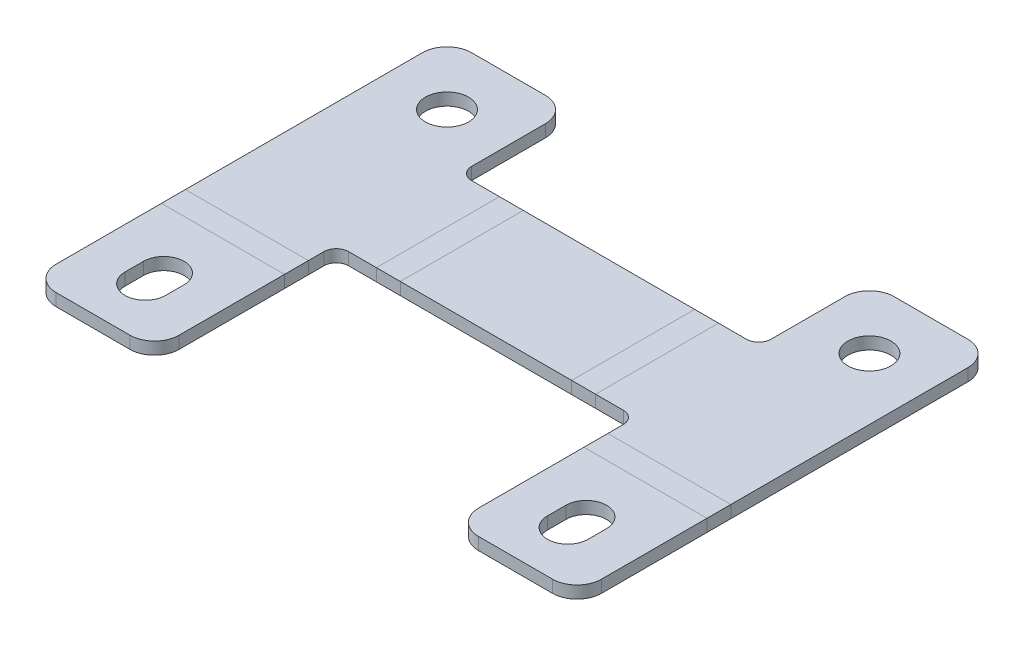
from build123d import *

# Parameters (mm, degrees)
SKETCH1_W                    = 7.7
SKETCH1_H                    = 10
BASE_FLANGE1_DEPTH           = 1
EDGE_FLANGE1_STRIP_W         = 5.4732
EDGE_FLANGE1_STRIP_H         = 1
EDGE_FLANGE1_STRIP_CUT_DEPTH = 10
EDGE_FLANGE1_DEPTH           = 10
SKETCH11_W                   = 23
SKETCH11_H                   = 10
TAB1_DEPTH                   = 1
FILLET1_R                    = 1
FILLET2_R                    = 2
SKETCH15_R                   = 1.75
CUT_EXTRUDE1_DEPTH           = 22.626141588
EDGE_FLANGE2_STRIP_W         = 5.4732
EDGE_FLANGE2_STRIP_H         = 1
EDGE_FLANGE2_STRIP_CUT_DEPTH = 10
EDGE_FLANGE2_DEPTH           = 10
CUT_EXTRUDE2_DEPTH           = 33.86335345
FILLET3_R                    = 2
UNFOLD1_DEPTH                = 14
UNFOLD1_START                = -1
UNFOLD1_2_OUTLINE_R          = 1.75
UNFOLD1_2_DEPTH              = 1


# Read off the part's stored shape, not the designer's step: Unfold1
# Sheet-metal steps are written as plain solids
with BuildPart() as part:
    # Sketch1 → Base-Flange1 (new body)
    with BuildSketch(Plane(origin=(0, 0, 0), x_dir=(1, 0, 0), z_dir=(0, 1, 0))):
        with Locations((3.85, 0)):
            Rectangle(SKETCH1_W, SKETCH1_H)
    extrude(amount=-BASE_FLANGE1_DEPTH)

    # Edge-Flange1 strip (across the edge) → Edge-Flange1 strip cut (cut)
    with BuildSketch(Plane(origin=(7.7, 0, 5), x_dir=(-1, 0, 0), z_dir=(0, 0, -1))):
        with Locations((-2, -0.5)):
            Rectangle(EDGE_FLANGE1_STRIP_W, EDGE_FLANGE1_STRIP_H)
    extrude(amount=EDGE_FLANGE1_STRIP_CUT_DEPTH, mode=Mode.SUBTRACT)

    # Edge-Flange1 section (across the edge) → Edge-Flange1 (add)
    with BuildSketch(Plane(origin=(7.7, 0, 5), x_dir=(-1, 0, 0), z_dir=(0, 0, -1))):
        with BuildLine():
            Line((-1, 0.7366), (-1, 4))
            Line((-1, 4), (0, 4))
            Line((0, 4), (0, 0.7366))
            ThreePointArc((0, 0.7366), (0.215745145, 0.215745145), (0.7366, 0))
            Line((0.7366, 0), (0.7366, -1))
            ThreePointArc((0.7366, -1), (-0.491361636, -0.491361636), (-1, 0.7366))
        make_face()
    extrude(amount=EDGE_FLANGE1_DEPTH)

    # Sketch11 → Tab1 (add)
    with BuildSketch(Plane(origin=(8.7, 0, 0), x_dir=(0, 0, -1), z_dir=(1, 0, 0))):
        with Locations((2.5, 9)):
            Rectangle(SKETCH11_W, SKETCH11_H)
    extrude(amount=-TAB1_DEPTH)

    # Fillet1
    fillet1_edges = [part.edges().sort_by_distance(p)[0] for p in [
        (8.2, 4, 5),
        (8.2, 4, -5),
    ]]
    fillet(fillet1_edges, radius=FILLET1_R)

    # Fillet2
    fillet2_edges = [part.edges().sort_by_distance(p)[0] for p in [
        (8.2, 14, -14),
        (8.2, 4, -14),
    ]]
    fillet(fillet2_edges, radius=FILLET2_R)

    # Sketch15 → Cut-Extrude1 (cut, through all)
    with BuildSketch(Plane(origin=(8.7, 0, 0), x_dir=(0, 0, -1), z_dir=(1, 0, 0))):
        with Locations(Location((9, 9, 0), (0, 0, 90))):
            Circle(SKETCH15_R)
    extrude(amount=-CUT_EXTRUDE1_DEPTH, mode=Mode.SUBTRACT)

    # Edge-Flange2 strip (across the edge) → Edge-Flange2 strip cut (cut)
    with BuildSketch(Plane(origin=(8.7, 14, 9), x_dir=(0, 0, -1), z_dir=(0, -1, 0))):
        with Locations((-1, -0.5)):
            Rectangle(EDGE_FLANGE2_STRIP_W, EDGE_FLANGE2_STRIP_H)
    extrude(amount=EDGE_FLANGE2_STRIP_CUT_DEPTH, mode=Mode.SUBTRACT)

    # Edge-Flange2 section (across the edge) → Edge-Flange2 (add)
    with BuildSketch(Plane(origin=(8.7, 14, 9), x_dir=(0, 0, -1), z_dir=(0, -1, 0))):
        with BuildLine():
            Line((0, 0.7366), (0, 11.3))
            Line((0, 11.3), (1, 11.3))
            Line((1, 11.3), (1, 0.7366))
            ThreePointArc((1, 0.7366), (1.215745145, 0.215745145), (1.7366, 0))
            Line((1.7366, 0), (1.7366, -1))
            ThreePointArc((1.7366, -1), (0.508638364, -0.491361636), (0, 0.7366))
        make_face()
    extrude(amount=EDGE_FLANGE2_DEPTH)

    # Sketch23 → Cut-Extrude2 (cut, through all)
    with BuildSketch(Plane(origin=(0, 0, 8), x_dir=(-1, 0, 0), z_dir=(0, 0, -1))):
        with BuildLine():
            Line((-15.75, 10.65), (-14.25, 10.65))
            ThreePointArc((-14.25, 10.65), (-12.6, 9), (-14.25, 7.35))
            Line((-14.25, 7.35), (-15.75, 7.35))
            ThreePointArc((-15.75, 7.35), (-17.4, 9), (-15.75, 10.65))
        make_face()
    extrude(amount=-CUT_EXTRUDE2_DEPTH, mode=Mode.SUBTRACT)

    # Fillet3
    fillet3_edges = [part.edges().sort_by_distance(p)[0] for p in [
        (20, 14, 8.5),
        (20, 4, 8.5),
    ]]
    fillet(fillet3_edges, radius=FILLET3_R)

    # Mirror1: part across plane


with BuildPart() as part_1:
    add(part.part)
    add(part.part.mirror(Plane(origin=(0, -1, -5), x_dir=(0, 0, 1), z_dir=(-1, 0, 0))))

    # Unfold1 outline → Unfold1 (cut)
    with BuildSketch(Plane(origin=(0, 0, 0), x_dir=(1, 0, 0), z_dir=(0, 1, 0))):
        with BuildLine():
            Line((-7.7, 5), (-7.7, 14))
            Line((-7.7, 14), (-8.7, 14))
            Line((-8.7, 14), (-8.7, -7.2634))
            ThreePointArc((-8.7, -7.2634), (-8.915745145, -7.784254855), (-9.4366, -8))
            Line((-9.4366, -8), (-20, -8))
            Line((-20, -8), (-20, -9))
            Line((-20, -9), (-9.4366, -9))
            ThreePointArc((-9.4366, -9), (-8.208638364, -8.491361636), (-7.7, -7.2634))
            Line((-7.7, -7.2634), (-7.7, -5))
            Line((-7.7, -5), (7.7, -5))
            Line((7.7, -5), (7.7, -7.2634))
            ThreePointArc((7.7, -7.2634), (8.208638364, -8.491361636), (9.4366, -9))
            Line((9.4366, -9), (20, -9))
            Line((20, -9), (20, -8))
            Line((20, -8), (9.4366, -8))
            ThreePointArc((9.4366, -8), (8.915745145, -7.784254855), (8.7, -7.2634))
            Line((8.7, -7.2634), (8.7, 14))
            Line((8.7, 14), (7.7, 14))
            Line((7.7, 14), (7.7, 5))
            Line((7.7, 5), (-7.7, 5))
        make_face()
    extrude(amount=UNFOLD1_DEPTH, mode=Mode.SUBTRACT)

    # Unfold1 2 outline → Unfold1 2 (add)
    with BuildSketch(Plane(origin=(0, 0, 0), x_dir=(1, 0, 0), z_dir=(0, 1, 0)).offset(UNFOLD1_START)):
        with BuildLine():
            ThreePointArc((-11.169246738, 5), (-11.876353519, 5.292893219), (-12.169246738, 6))
            Line((-12.169246738, 6), (-12.169246738, 12))
            ThreePointArc((-12.169246738, 12), (-12.755033175, 13.414213563), (-14.169246738, 14))
            Line((-14.169246738, 14), (-20.169246738, 14))
            ThreePointArc((-20.169246738, 14), (-21.5834603, 13.414213562), (-22.169246738, 12))
            Line((-22.169246738, 12), (-22.169246738, -17.769246738))
            ThreePointArc((-22.169246738, -17.769246738), (-21.5834603, -19.1834603), (-20.169246738, -19.769246738))
            Line((-20.169246738, -19.769246738), (-14.169246738, -19.769246738))
            ThreePointArc((-14.169246738, -19.769246738), (-12.755033175, -19.183460301), (-12.169246738, -17.769246738))
            Line((-12.169246738, -17.769246738), (-12.169246738, -6))
            ThreePointArc((-12.169246738, -6), (-11.876353519, -5.292893219), (-11.169246738, -5))
            Line((-11.169246738, -5), (11.169246738, -5))
            ThreePointArc((11.169246738, -5), (11.876353519, -5.292893219), (12.169246738, -6))
            Line((12.169246738, -6), (12.169246738, -17.769246738))
            ThreePointArc((12.169246738, -17.769246738), (12.755033175, -19.183460301), (14.169246738, -19.769246738))
            Line((14.169246738, -19.769246738), (20.169246738, -19.769246738))
            ThreePointArc((20.169246738, -19.769246738), (21.5834603, -19.1834603), (22.169246738, -17.769246738))
            Line((22.169246738, -17.769246738), (22.169246738, 12))
            ThreePointArc((22.169246738, 12), (21.5834603, 13.414213562), (20.169246738, 14))
            Line((20.169246738, 14), (14.169246738, 14))
            ThreePointArc((14.169246738, 14), (12.755033175, 13.414213563), (12.169246738, 12))
            Line((12.169246738, 12), (12.169246738, 6))
            ThreePointArc((12.169246738, 6), (11.876353519, 5.292893219), (11.169246738, 5))
            Line((11.169246738, 5), (-11.169246738, 5))
        make_face()
        with Locations((17.169246738, 9)):
            Circle(UNFOLD1_2_OUTLINE_R, mode=Mode.SUBTRACT)
        with BuildLine():
            Line((15.519246738, -15.519246738), (15.519246738, -14.019246738))
            ThreePointArc((15.519246738, -14.019246738), (17.169246738, -12.369246738), (18.819246738, -14.019246738))
            Line((18.819246738, -14.019246738), (18.819246738, -15.519246738))
            ThreePointArc((18.819246738, -15.519246738), (17.169246738, -17.169246738), (15.519246738, -15.519246738))
        make_face(mode=Mode.SUBTRACT)
        with Locations((-17.169246738, 9)):
            Circle(UNFOLD1_2_OUTLINE_R, mode=Mode.SUBTRACT)
        with BuildLine():
            Line((-15.519246738, -14.019246738), (-15.519246738, -15.519246738))
            ThreePointArc((-15.519246738, -15.519246738), (-17.169246738, -17.169246738), (-18.819246738, -15.519246738))
            Line((-18.819246738, -15.519246738), (-18.819246738, -14.019246738))
            ThreePointArc((-18.819246738, -14.019246738), (-17.169246738, -12.369246738), (-15.519246738, -14.019246738))
        make_face(mode=Mode.SUBTRACT)
    extrude(amount=UNFOLD1_2_DEPTH)


solid = part_1.part
